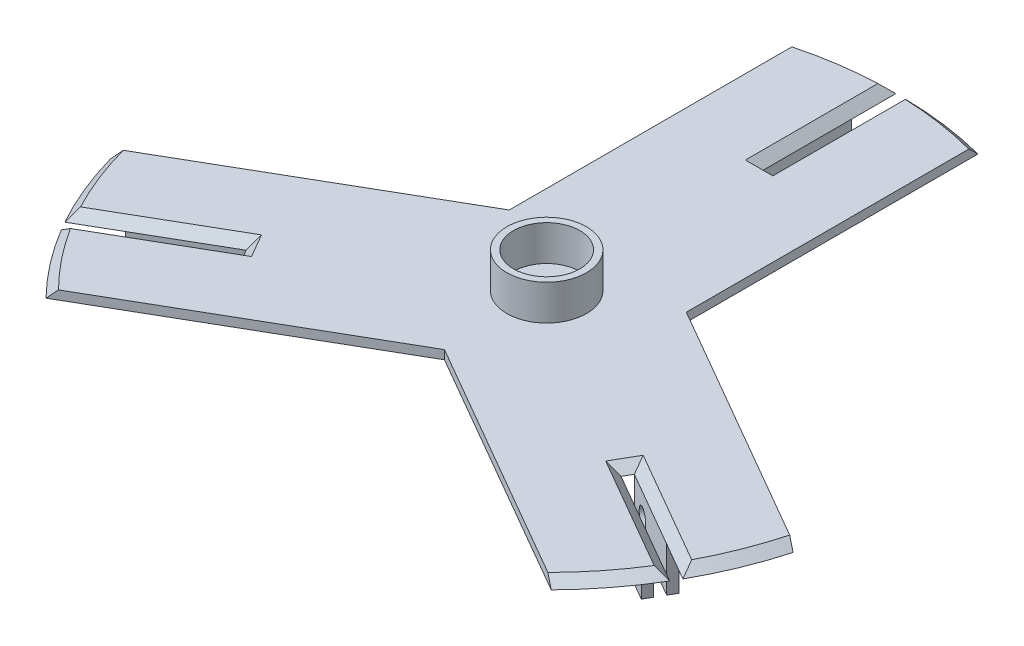
from build123d import *

# Parameters (mm, degrees)
BOSS_EXTRUDE1_DEPTH = 2
BOSS_EXTRUDE1_DRAFT = 45
SKETCH2_R           = 2.5
CUT_EXTRUDE1_DEPTH  = 114.154761278
SKETCH3_R           = 9
SKETCH3_R_2         = 7.5
BOSS_EXTRUDE2_DEPTH = 8
SKETCH4_W           = 2
SKETCH4_H           = 20
BOSS_EXTRUDE3_DEPTH = 10
SKETCH5_R           = 2
CUT_EXTRUDE2_DEPTH  = 10
CIRPATTERN1_COUNT   = 3
CUT_EXTRUDE3_DEPTH  = 1000


# Read off the part's stored shape, not the designer's step: Boss-Extrude1
with BuildPart() as part:
    # Boss-Extrude1 outline → Boss-Extrude1 (with draft: the straight prism first)
    with BuildSketch(Plane(origin=(0, 2, 0), x_dir=(1, 0, 0), z_dir=(0, 1, 0))):
        with BuildLine():
            ThreePointArc((-3.1, 77.938373091), (-67.549981495, 39), (-69.046611026, -36.284507794))
            Line((-69.046611026, -36.284507794), (-43.119219382, -21.315321248))
            Line((-43.119219382, -21.315321248), (-40.019219382, -26.684678752))
            Line((-40.019219382, -26.684678752), (-65.946611026, -41.653865297))
            ThreePointArc((-65.946611026, -41.653865297), (0, -78), (65.946611026, -41.653865297))
            Line((65.946611026, -41.653865297), (40.019219382, -26.684678752))
            Line((40.019219382, -26.684678752), (43.119219382, -21.315321248))
            Line((43.119219382, -21.315321248), (69.046611026, -36.284507794))
            ThreePointArc((69.046611026, -36.284507794), (67.549981495, 39), (3.1, 77.938373091))
            Line((3.1, 77.938373091), (3.1, 48))
            Line((3.1, 48), (-3.1, 48))
            Line((-3.1, 48), (-3.1, 77.938373091))
        make_face()
    extrude(amount=-BOSS_EXTRUDE1_DEPTH)
    # Boss-Extrude1: the draft: its side faces are tilted about the plane it starts from
    boss_extrude1_sides = [part.faces().sort_by_distance(p)[0] for p in [
        (67.549981495, 1, -39),
        (3.1, 1, -62.969186546),
        (0, 1, -48),
        (-3.1, 1, -62.969186546),
        (-67.549981495, 1, -39),
        (-56.082915204, 1, 28.799914521),
        (-41.569219382, 1, 24),
        (-52.982915204, 1, 34.169272025),
        (0, 1, 78),
        (52.982915204, 1, 34.169272025),
        (41.569219382, 1, 24),
        (56.082915204, 1, 28.799914521),
    ]]
    draft(boss_extrude1_sides, Plane(origin=(0, 2, 0), x_dir=(1, 0, 0), z_dir=(0, 1, 0)), BOSS_EXTRUDE1_DRAFT)

    # Sketch2 → Cut-Extrude1 (cut, through all)
    with BuildSketch(Plane(origin=(0, 2, 0), x_dir=(1, 0, 0), z_dir=(0, 1, 0))):
        with Locations(Location((0, 0, 0), (0, 0, 270))):
            Circle(SKETCH2_R)
    extrude(amount=-CUT_EXTRUDE1_DEPTH, mode=Mode.SUBTRACT)

    # Sketch3 → Boss-Extrude2 (add)
    with BuildSketch(Plane(origin=(0, 2, 0), x_dir=(1, 0, 0), z_dir=(0, 1, 0))):
        with Locations(Location((0, 0, 0), (0, 0, 270))):
            Circle(SKETCH3_R)
        with Locations(Location((0, 0, 0), (0, 0, 270))):
            Circle(SKETCH3_R_2, mode=Mode.SUBTRACT)
    extrude(amount=BOSS_EXTRUDE2_DEPTH)

    # Sketch4 → Boss-Extrude3 (add)
    with BuildSketch(Plane.XZ):
        Polygon((42.751270189, 25.952627944), (60.071778265, 35.952627944), (59.071778265, 37.684678752), (41.751270189, 27.684678752), align=None)
        Polygon((43.851270189, 24.047372056), (61.171778265, 34.047372056), (62.171778265, 32.315321248), (44.851270189, 22.315321248), align=None)
        with Locations((2.1, -60)):
            Rectangle(SKETCH4_W, SKETCH4_H)
        with Locations((-2.1, -60)):
            Rectangle(SKETCH4_W, SKETCH4_H)
        Polygon((-44.851270189, 22.315321248), (-62.171778265, 32.315321248), (-61.171778265, 34.047372056), (-43.851270189, 24.047372056), align=None)
        Polygon((-42.751270189, 25.952627944), (-60.071778265, 35.952627944), (-59.071778265, 37.684678752), (-41.751270189, 27.684678752), align=None)
    extrude(amount=BOSS_EXTRUDE3_DEPTH)

    # Sketch5 → Cut-Extrude2 (cut)
    with BuildSketch(Plane(origin=(3.1, 0, 0), x_dir=(0, 0, -1), z_dir=(1, 0, 0))):
        with Locations((55, -5)):
            Circle(SKETCH5_R)
    cut_extrude2 = extrude(amount=-CUT_EXTRUDE2_DEPTH, mode=Mode.SUBTRACT)

    # CirPattern1: Cut-Extrude2 ×3 about axis
    cirpattern1_axis = Axis((0, 10, 0), (0, -1, 0))
    for i in range(1, CIRPATTERN1_COUNT):
        add(cut_extrude2.rotate(cirpattern1_axis, i * 360 / CIRPATTERN1_COUNT), mode=Mode.SUBTRACT)

    # Sketch6 → Cut-Extrude3 (cut)
    with BuildSketch(Plane(origin=(0, 2, 0), x_dir=(1, 0, 0), z_dir=(0, 1, 0))):
        with BuildLine():
            Line((20, 75.3923073), (20, 77.459666924))
            ThreePointArc((20, 77.459666924), (69.282032303, 40), (77.082039325, -21.409325386))
            Line((77.082039325, -21.409325386), (75.291653372, -20.375645574))
            Line((75.291653372, -20.375645574), (20, 11.547005384))
            Line((20, 11.547005384), (20, 75.3923073))
        make_face()
        with BuildLine():
            Line((-31.569219382, -41.320508076), (0, -23.094010768))
            Line((0, -23.094010768), (31.569219382, -41.320508076))
            Line((31.569219382, -41.320508076), (55.291653372, -55.016661726))
            Line((55.291653372, -55.016661726), (57.082039325, -56.050341538))
            ThreePointArc((57.082039325, -56.050341538), (0, -80), (-57.082039325, -56.050341538))
            Line((-57.082039325, -56.050341538), (-55.291653372, -55.016661726))
            Line((-55.291653372, -55.016661726), (-31.569219382, -41.320508076))
        make_face()
        with BuildLine():
            Line((-51.569219382, -6.679491924), (-20, 11.547005384))
            Line((-20, 11.547005384), (-20, 75.3923073))
            Line((-20, 75.3923073), (-20, 77.459666924))
            ThreePointArc((-20, 77.459666924), (-69.282032303, 40), (-77.082039325, -21.409325386))
            Line((-77.082039325, -21.409325386), (-75.291653372, -20.375645574))
            Line((-75.291653372, -20.375645574), (-51.569219382, -6.679491924))
        make_face()
    extrude(amount=-CUT_EXTRUDE3_DEPTH, mode=Mode.SUBTRACT)


solid = part.part
